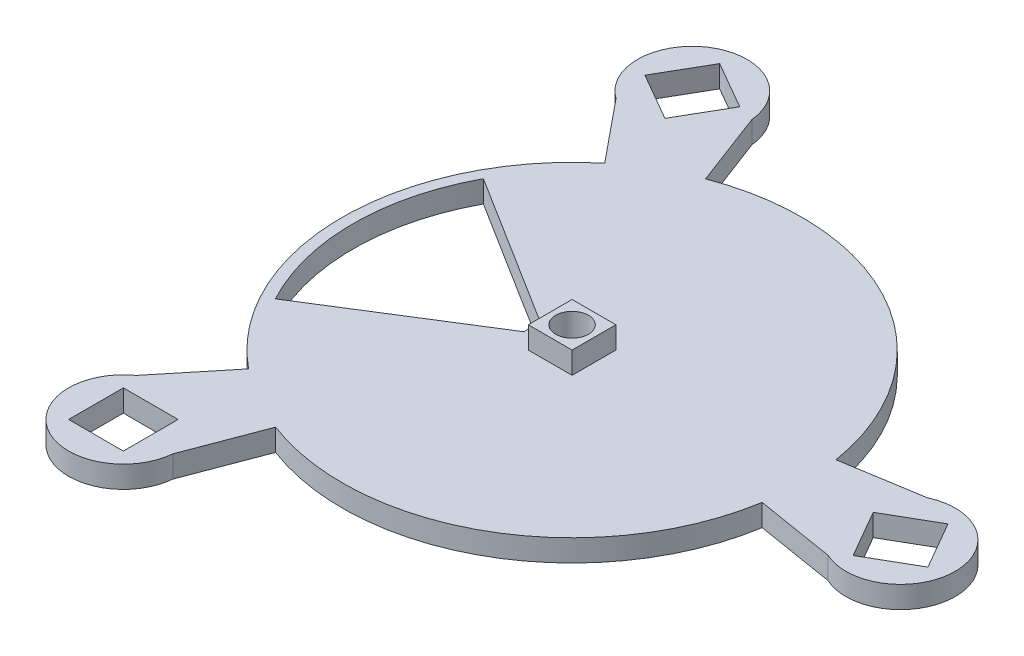
from build123d import *

# Parameters (mm, degrees)
SKETCH1_W           = 5
SKETCH1_H           = 5
BOSS_EXTRUDE1_DEPTH = 2
SKETCH2_W           = 4
SKETCH2_H           = 4
BOSS_EXTRUDE2_DEPTH = 2
CUT_EXTRUDE1_REACH  = 48.913
SKETCH3_R           = 1.5
CUT_EXTRUDE2_REACH  = 48.785


with BuildPart() as part:
    # Sketch1 → Boss-Extrude1 (new body)
    with BuildSketch(Plane(origin=(0, 0, 0), x_dir=(1, 0, 0), z_dir=(0, 1, 0))):
        with BuildLine():
            ThreePointArc((-7.442772198, -19.636831262), (10.5, -18.186533479), (20.727380822, -3.372785833))
            Line((20.727380822, -3.372785833), (27.907701299, -4.541176736))
            ThreePointArc((27.907701299, -4.541176736), (35, 0), (27.907701299, 4.541176736))
            Line((27.907701299, 4.541176736), (20.727380822, 3.372785833))
            ThreePointArc((20.727380822, 3.372785833), (10.5, 18.186533479), (-7.442772198, 19.636831262))
            Line((-7.442772198, 19.636831262), (-10.021076233, 26.439366654))
            ThreePointArc((-10.021076233, 26.439366654), (-17.5, 30.310889132), (-17.886625066, 21.898189918))
            Line((-17.886625066, 21.898189918), (-13.284608624, 16.264045429))
            ThreePointArc((-13.284608624, 16.264045429), (-21, 0), (-13.284608624, -16.264045429))
            Line((-13.284608624, -16.264045429), (-17.886625066, -21.898189918))
            ThreePointArc((-17.886625066, -21.898189918), (-17.5, -30.310889132), (-10.021076233, -26.439366654))
            Line((-10.021076233, -26.439366654), (-7.442772198, -19.636831262))
        make_face()
        with Locations((-15, -25.980762114)):
            Rectangle(SKETCH1_W, SKETCH1_H, mode=Mode.SUBTRACT)
        Polygon((26.584936491, 0.915063509), (30.915063509, 3.415063509), (33.415063509, -0.915063509), (29.084936491, -3.415063509), align=None, mode=Mode.SUBTRACT)
        Polygon((-11.584936491, 26.895825623), (-14.084936491, 22.565698604), (-18.415063509, 25.065698604), (-15.915063509, 29.395825623), align=None, mode=Mode.SUBTRACT)
    extrude(amount=BOSS_EXTRUDE1_DEPTH)

    # Sketch2 → Boss-Extrude2 (add)
    with BuildSketch(Plane(origin=(0, 2, 0), x_dir=(1, 0, 0), z_dir=(0, 1, 0))):
        Rectangle(SKETCH2_W, SKETCH2_H)
    extrude(amount=BOSS_EXTRUDE2_DEPTH)

    # Sketch3 → Cut-Extrude1 (cut, up to next)
    with BuildSketch(Plane(origin=(0, 4, 0), x_dir=(1, 0, 0), z_dir=(0, 1, 0)), mode=Mode.PRIVATE) as cut_extrude1_sk1:
        Circle(SKETCH3_R)
    cut_extrude1_tool1 = extrude(cut_extrude1_sk1.sketch, amount=-CUT_EXTRUDE1_REACH, mode=Mode.PRIVATE) & part.part
    add(cut_extrude1_tool1.solids().sort_by_distance((0, 4, 0))[0], mode=Mode.SUBTRACT)

    # Sketch4 → Cut-Extrude2 (cut, up to next)
    with BuildSketch(Plane(origin=(0, 2, 0), x_dir=(1, 0, 0), z_dir=(0, 1, 0)), mode=Mode.PRIVATE) as cut_extrude2_sk1:
        with BuildLine():
            Line((-3.620274752, -0.735), (-17.599715907, -9.5))
            ThreePointArc((-17.599715907, -9.5), (-20, 0), (-17.599715907, 9.5))
            Line((-17.599715907, 9.5), (-3.620274752, 0.735))
            ThreePointArc((-3.620274752, 0.735), (-3.694132412, 0), (-3.620274752, -0.735))
        make_face()
    cut_extrude2_tool1 = extrude(cut_extrude2_sk1.sketch, amount=-CUT_EXTRUDE2_REACH, mode=Mode.PRIVATE) & part.part
    add(cut_extrude2_tool1.solids().sort_by_distance((-13.664779, 2, 0))[0], mode=Mode.SUBTRACT)


solid = part.part
